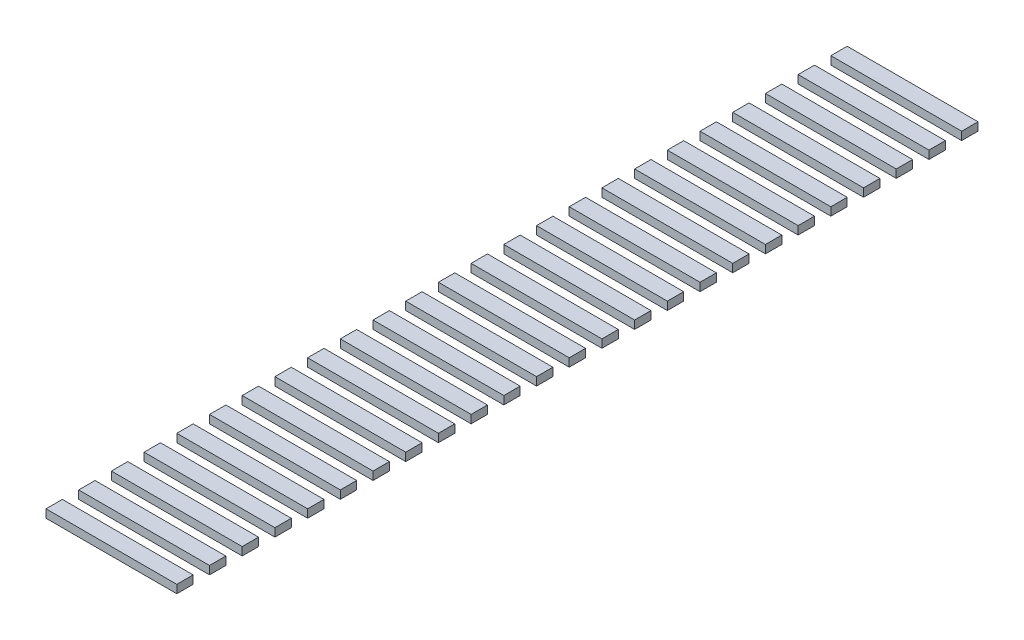
from build123d import *

# Parameters (mm, degrees)
SKETCH1_W           = 160
SKETCH1_H           = 1000
BOSS_EXTRUDE1_DEPTH = 10
CUT_EXTRUDE1_REACH  = 508.458
SKETCH2_W           = 160
SKETCH2_H           = 20
LPATTERN1_COUNT     = 25
LPATTERN1_PITCH     = 40


with BuildPart() as part:
    # Sketch1 → Boss-Extrude1 (new body)
    with BuildSketch(Plane(origin=(0, 0, 0), x_dir=(1, 0, 0), z_dir=(0, 1, 0))):
        Rectangle(SKETCH1_W, SKETCH1_H)
    extrude(amount=BOSS_EXTRUDE1_DEPTH)

    # Sketch2 → Cut-Extrude1 (cut, up to next)
    with BuildSketch(Plane(origin=(0, 10, 0), x_dir=(1, 0, 0), z_dir=(0, 1, 0)), mode=Mode.PRIVATE) as cut_extrude1_sk1:
        with Locations((0, 470)):
            Rectangle(SKETCH2_W, SKETCH2_H)
    cut_extrude1_tool1 = extrude(cut_extrude1_sk1.sketch, amount=-CUT_EXTRUDE1_REACH, mode=Mode.PRIVATE) & part.part
    cut_extrude1 = cut_extrude1_tool1.solids().sort_by_distance((0, 10, -470))[0]
    add(cut_extrude1, mode=Mode.SUBTRACT)


with BuildPart() as cut_extrude1_piece_1:
    # of the separate pieces the step leaves, piece 1, a body of its own (cut_extrude1_pieces)
    add(part.part.solids().sort_by_distance((-80, 0, 500))[0])

    # LPattern1: Cut-Extrude1 ×25
    with Locations(*[(0, 0, i * LPATTERN1_PITCH) for i in range(1, LPATTERN1_COUNT)]):
        add(cut_extrude1, mode=Mode.SUBTRACT)


with BuildPart() as cut_extrude1_piece_2:
    # of the separate pieces the step leaves, piece 2, a body of its own (cut_extrude1_pieces)
    add(part.part.solids().sort_by_distance((-80, 0, -500))[0])


solid = Compound([cut_extrude1_piece_1.part, cut_extrude1_piece_2.part])
